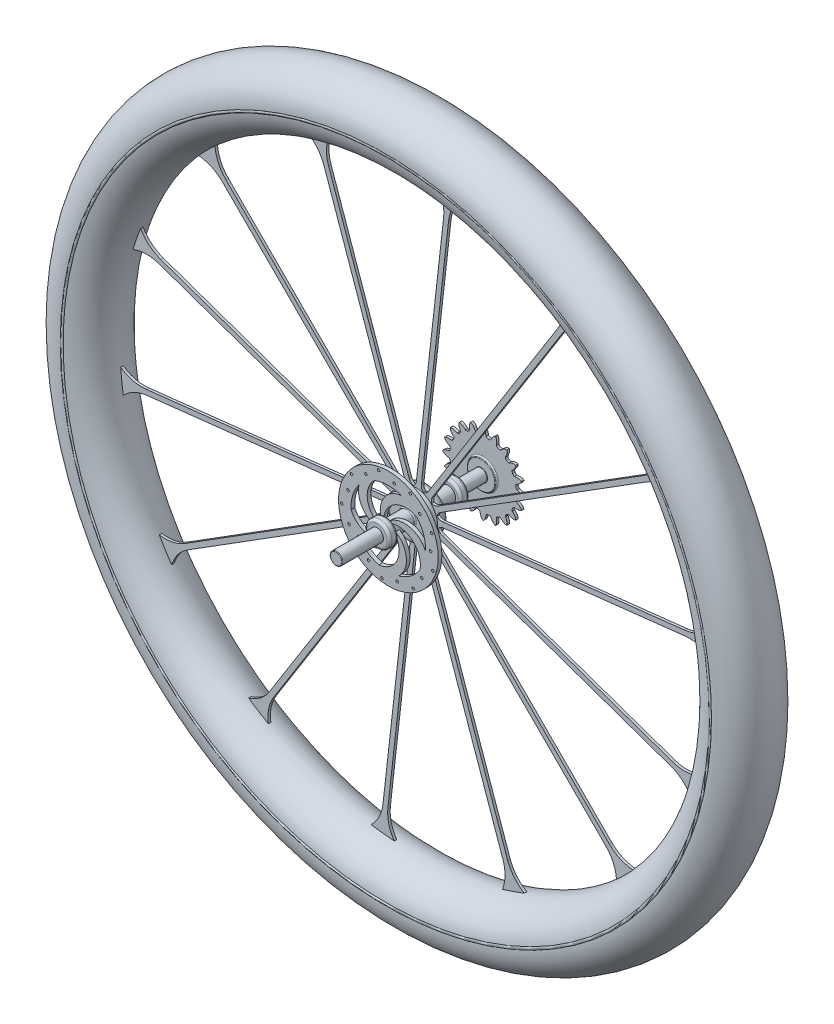
from build123d import *

# Parameters (mm, degrees)
SKETCH1_R               = 10
BOSS_EXTRUDE1_DEPTH     = 32
SKETCH1_5_R             = 5
BOSS_EXTRUDE2_DEPTH     = 65
SKETCH4_OUTSIDE_W       = 48.608
SKETCH4_OUTSIDE_H       = 48.608
SKETCH4_OUTSIDE_R       = 6
CUT_EXTRUDE1_DEPTH      = 25
FILLET3_R               = 2
FILLET4_R               = 2
FILLET5_R               = 0.5
SKETCH5_R               = 17.5
BOSS_EXTRUDE3_DEPTH     = 7.5
FILLET6_R               = 3
FILLET7_R               = 1
BOSS_EXTRUDE4_START     = 20
SKETCH6_R               = 40
SKETCH6_R_2             = 1
BOSS_EXTRUDE4_DEPTH     = 3
BOSS_EXTRUDE8_DEPTH     = 1
CIRPATTERN1_COUNT       = 14
SWEEP2_PROFILE_R        = 25
BOSS_EXTRUDE9_START     = -55
BOSS_EXTRUDE9_OUTLINE_R = 5
BOSS_EXTRUDE9_DEPTH     = 2
BOSS_EXTRUDE10_START    = -56.5
SKETCH54_R              = 11.326091277
BOSS_EXTRUDE10_DEPTH    = 5
FILLET8_R               = 0.2
FILLET9_R               = 1
FILLET10_R              = 0.5


# Read off the part's stored shape, not the designer's step: Boss-Extrude9
with BuildPart() as part:
    # Sketch1 → Boss-Extrude1 (new, symmetric)
    with BuildSketch(Plane.XY):
        Circle(SKETCH1_R)
    extrude(amount=BOSS_EXTRUDE1_DEPTH, both=True)

    # Sketch1<5> → Boss-Extrude2 (add, symmetric)
    with BuildSketch(Plane.XY):
        Circle(SKETCH1_5_R)
    extrude(amount=BOSS_EXTRUDE2_DEPTH, both=True)

    # Sketch4 outside → Cut-Extrude1 (cut, symmetric)
    with BuildSketch(Plane.XY):
        Rectangle(SKETCH4_OUTSIDE_W, SKETCH4_OUTSIDE_H)
        Circle(SKETCH4_OUTSIDE_R, mode=Mode.SUBTRACT)
    extrude(amount=CUT_EXTRUDE1_DEPTH, both=True, mode=Mode.SUBTRACT)

    # Fillet3
    fillet3_edges = [part.edges().sort_by_distance(p)[0] for p in [
        (-10, 0, -25),
        (-10, 0, -32),
    ]]
    fillet(fillet3_edges, radius=FILLET3_R)

    # Fillet4
    fillet4_edges = [part.edges().sort_by_distance(p)[0] for p in [
        (-10, 0, 32),
        (-10, 0, 25),
    ]]
    fillet(fillet4_edges, radius=FILLET4_R)

    # Fillet5
    fillet5_edges = [part.edges().sort_by_distance(p)[0] for p in [
        (-5, 0, -65),
        (-5, 0, 65),
    ]]
    fillet(fillet5_edges, radius=FILLET5_R)

    # Sketch5 → Boss-Extrude3 (add, symmetric)
    with BuildSketch(Plane.XY):
        Circle(SKETCH5_R)
    extrude(amount=BOSS_EXTRUDE3_DEPTH, both=True)

    # Fillet6
    fillet6_edges = [part.edges().sort_by_distance(p)[0] for p in [
        (-17.5, 0, -7.5),
        (-17.5, 0, 7.5),
    ]]
    fillet(fillet6_edges, radius=FILLET6_R)

    # Fillet7
    fillet7_edges = [part.edges().sort_by_distance(p)[0] for p in [
        (-6, 0, 7.5),
        (-6, 0, -7.5),
    ]]
    fillet(fillet7_edges, radius=FILLET7_R)

    # Sketch6 → Boss-Extrude4 (add)
    with BuildSketch(Plane.XY.offset(BOSS_EXTRUDE4_START)):
        Circle(SKETCH6_R)
        with Locations((-27.829963859, -25.134500424)):
            Circle(SKETCH6_R_2, mode=Mode.SUBTRACT)
        with Locations((-15.916629656, -30.044315609)):
            Circle(SKETCH6_R_2, mode=Mode.SUBTRACT)
        with Locations((-5.162843718, -37.142900328)):
            Circle(SKETCH6_R_2, mode=Mode.SUBTRACT)
        with Locations((-31.504959516, -12.784268689)):
            Circle(SKETCH6_R_2, mode=Mode.SUBTRACT)
        with Locations((-37.475134615, -1.365388434)):
            Circle(SKETCH6_R_2, mode=Mode.SUBTRACT)
        with Locations((7.119268114, -33.24629335)):
            Circle(SKETCH6_R_2, mode=Mode.SUBTRACT)
        with Locations((19.920028377, -31.77172437)):
            Circle(SKETCH6_R_2, mode=Mode.SUBTRACT)
        with Locations((26.823981211, -20.891960941)):
            Circle(SKETCH6_R_2, mode=Mode.SUBTRACT)
        with Locations((35.682097809, -11.534205476)):
            Circle(SKETCH6_R_2, mode=Mode.SUBTRACT)
        with Locations((-32.35176868, 10.457679632)):
            Circle(SKETCH6_R_2, mode=Mode.SUBTRACT)
        with Locations((-29.585273395, 23.04260398)):
            Circle(SKETCH6_R_2, mode=Mode.SUBTRACT)
        with Locations((-18.060825729, 28.806363429)):
            Circle(SKETCH6_R_2, mode=Mode.SUBTRACT)
        with Locations((-7.852133949, 36.668705901)):
            Circle(SKETCH6_R_2, mode=Mode.SUBTRACT)
        with BuildLine():
            ThreePointArc((-10.988413518, 27.915135113), (-0.354739854, 29.997902587), (10.325212752, 28.167179156))
            ThreePointArc((10.325212752, 28.167179156), (-3.757528665, 19.399381921), (-5.26423558, 2.878858066))
            ThreePointArc((-5.26423558, 2.878858066), (-4.598952731, 3.853522256), (-3.755770696, 4.679122405))
            ThreePointArc((-3.755770696, 4.679122405), (5.662140485, 19.42231461), (23.153264634, 19.07685343))
            ThreePointArc((23.153264634, 19.07685343), (28.420080087, 9.607239345), (29.979245493, -1.115723827))
            ThreePointArc((29.979245493, -1.115723827), (17.288768374, 9.568360816), (1.111218467, 5.896201618))
            ThreePointArc((1.111218467, 5.896201618), (2.243762902, 5.564667828), (3.289512882, 5.017878536))
            ThreePointArc((3.289512882, 5.017878536), (20.221416506, 0.61680968), (25.297918012, -16.124991295))
            ThreePointArc((25.297918012, -16.124991295), (17.919315311, -24.060302134), (8.20297992, -28.856734403))
            ThreePointArc((8.20297992, -28.856734403), (14.442575143, -13.48580972), (5.951006361, 0.765194939))
            ThreePointArc((5.951006361, 0.765194939), (5.987739063, 0.383380904), (6, 0))
            ThreePointArc((6, 0), (5.946965982, -0.795987193), (5.788801463, -1.577902919))
            ThreePointArc((5.788801463, -1.577902919), (6.835382216, -19.041105264), (-7.518291458, -29.042646118))
            ThreePointArc((-7.518291458, -29.042646118), (-17.34533417, -24.477323843), (-24.909525094, -16.718718839))
            ThreePointArc((-24.909525094, -16.718718839), (-8.36276605, -17.903049589), (2.566705732, -5.423285138))
            ThreePointArc((2.566705732, -5.423285138), (1.455587364, -5.820761585), (0.288163176, -5.99307617))
            ThreePointArc((0.288163176, -5.99307617), (-15.996917971, -12.384859916), (-29.94447767, -1.82435113))
            ThreePointArc((-29.94447767, -1.82435113), (-28.639321374, 8.932484045), (-23.597913072, 18.523997913))
            ThreePointArc((-23.597913072, 18.523997913), (-19.611048802, 2.421116572), (-4.364694979, -4.116969484))
            ThreePointArc((-4.364694979, -4.116969484), (-5.086072002, -3.183060098), (-5.610706826, -2.126021852))
            ThreePointArc((-5.610706826, -2.126021852), (-16.722021237, 11.386840889), (-10.988413518, 27.915135113))
        make_face(mode=Mode.SUBTRACT)
        with Locations((33.977455384, 1.23795218)):
            Circle(SKETCH6_R_2, mode=Mode.SUBTRACT)
        with Locations((34.748117113, 14.100296348)):
            Circle(SKETCH6_R_2, mode=Mode.SUBTRACT)
        with Locations((4.680978305, 33.67622963)):
            Circle(SKETCH6_R_2, mode=Mode.SUBTRACT)
        with Locations((17.555106238, 33.137112804)):
            Circle(SKETCH6_R_2, mode=Mode.SUBTRACT)
        with Locations((25.232500566, 22.788613718)):
            Circle(SKETCH6_R_2, mode=Mode.SUBTRACT)
    extrude(amount=BOSS_EXTRUDE4_DEPTH)

    # Sketch8 → Boss-Extrude8 (add, symmetric)
    with BuildSketch(Plane.XY):
        with BuildLine():
            ThreePointArc((-15.847816988, 7.422714915), (-12.374368671, 12.374368671), (-7.422714915, 15.847816988))
            ThreePointArc((-7.422714915, 15.847816988), (-11.004522471, 15.371626105), (-14.21028643, 17.038713554))
            Line((-14.21028643, 17.038713554), (-152.494850498, 155.323277623))
            ThreePointArc((-152.494850498, 155.323277623), (-161.201777759, 178.724123423), (-149.183689844, 200.609637567))
            ThreePointArc((-149.183689844, 200.609637567), (-176.776695297, 176.776695297), (-200.609637567, 149.183689844))
            ThreePointArc((-200.609637567, 149.183689844), (-178.724123423, 161.201777759), (-155.323277623, 152.494850498))
            Line((-155.323277623, 152.494850498), (-17.038713554, 14.21028643))
            ThreePointArc((-17.038713554, 14.21028643), (-15.371626105, 11.004522471), (-15.847816988, 7.422714915))
        make_face()
    boss_extrude8 = extrude(amount=BOSS_EXTRUDE8_DEPTH, both=True)

    # CirPattern1: Boss-Extrude8 ×14 about axis
    cirpattern1_axis = Axis((0, 0, 0), (0, 0, 1))
    for i in range(1, CIRPATTERN1_COUNT):
        add(boss_extrude8.rotate(cirpattern1_axis, i * 360 / CIRPATTERN1_COUNT))

    # Sketch28 → Revolve2 (revolve)
    with BuildSketch(Plane(origin=(-158.659775862, 199.629846274, 0), x_dir=(0, 0, 1), z_dir=(-0.7828621422498412, -0.6221951994607396, 0)), mode=Mode.PRIVATE) as revolve2_sk:
        with BuildLine():
            Line((-18.133205272, -4.636575391), (-22.581894268, 3.079745459))
            ThreePointArc((-22.581894268, 3.079745459), (-22.826148414, 3.380932745), (-23.152080767, 3.591032651))
            Line((-23.152080767, 3.591032651), (-24.580850557, 4.219111072))
            ThreePointArc((-24.580850557, 4.219111072), (-25.379303955, 5.224614361), (-25, 6.451273729))
            Line((-25, 6.451273729), (25, 6.451273729))
            ThreePointArc((25, 6.451273729), (25.379303955, 5.224614361), (24.580850557, 4.219111072))
            Line((24.580850557, 4.219111072), (23.152080767, 3.591032651))
            ThreePointArc((23.152080767, 3.591032651), (22.826148414, 3.380932745), (22.581894268, 3.079745459))
            Line((22.581894268, 3.079745459), (18.133205272, -4.636575391))
            ThreePointArc((18.133205272, -4.636575391), (16.302872781, -6.46859869), (13.801540167, -7.13924133))
            Line((13.801540167, -7.13924133), (0, -7.13924133))
            Line((0, -7.13924133), (-13.801540167, -7.13924133))
            ThreePointArc((-13.801540167, -7.13924133), (-16.302872781, -6.46859869), (-18.133205272, -4.636575391))
        make_face()
    revolve(revolve2_sk.sketch.rotate(Axis((0, 0, -64.5), (0, 0, -1)), 128.476617376), axis=Axis((0, 0, -64.5), (0, 0, -1)))

    # Sweep2: sweep along a path in Sketch30
    with BuildLine(Plane.XY) as sweep2_path:
        CenterArc((0, 0), 262.5, 0, 360)
    # Sweep2 profile (on start of the path) → Sweep2 (sweep)
    with BuildSketch(Plane(origin=(262.5, 0, 0), x_dir=(0, 0, 1), z_dir=(0, 1, 0))):
        Circle(SWEEP2_PROFILE_R)
    sweep(path=sweep2_path.line)

    # Boss-Extrude9 outline → Boss-Extrude9 (add)
    with BuildSketch(Plane.XY.offset(BOSS_EXTRUDE9_START)):
        with BuildLine():
            ThreePointArc((-20.928984964, 17.83893462), (-20.808155916, 17.979728791), (-20.68637973, 18.119704568))
            add(Edge.make_bspline(
                [(-20.68637973, 18.119704568), (-22.925550657, 19.029265096), (-24.165921378, 19.703947386), (-26.293052317, 19.1030207)],
                knots=[0, 0, 0, 0, 1, 1, 1, 1], degree=3))
            add(Edge.make_bspline(
                [(-23.625305992, 14.074619597), (-25.182291328, 15.923128037), (-26.207247949, 16.8943024), (-26.293052317, 19.1030207)],
                knots=[0, 0, 0, 0, 1, 1, 1, 1], degree=3))
            ThreePointArc((-23.625305992, 14.074619597), (-23.529812027, 14.233690525), (-23.433247043, 14.392113571))
            add(Edge.make_bspline(
                [(-23.770662791, 12.111757643), (-23.682791856, 12.264469454), (-23.177816023, 13.322083224), (-23.515185103, 14.199860603), (-23.433247043, 14.392113571)],
                knots=[0.475701449, 0.475701449, 0.475701449, 0.475701449, 0.55697972, 1, 1, 1, 1], degree=3))
            add(Edge.make_bspline(
                [(-23.770662791, 12.111757643), (-23.842560002, 11.950906814), (-24.401370167, 10.920723006), (-25.309807554, 10.677715727), (-25.417181489, 10.498422985)],
                knots=[0.475701449, 0.475701449, 0.475701449, 0.475701449, 0.55697972, 1, 1, 1, 1], degree=3))
            ThreePointArc((-25.417181489, 10.498422985), (-25.345774026, 10.669664428), (-25.273212886, 10.840420214))
            add(Edge.make_bspline(
                [(-25.273212886, 10.840420214), (-27.683860647, 11.013521811), (-29.072011597, 11.271887168), (-30.90933678, 10.043052317)],
                knots=[0, 0, 0, 0, 1, 1, 1, 1], degree=3))
            add(Edge.make_bspline(
                [(-26.818297858, 6.085137633), (-28.87029943, 7.362038702), (-30.145200486, 7.968951394), (-30.90933678, 10.043052317)],
                knots=[0, 0, 0, 0, 1, 1, 1, 1], degree=3))
            ThreePointArc((-26.818297858, 6.085137633), (-26.776633321, 6.265932334), (-26.733749976, 6.446441825))
            add(Edge.make_bspline(
                [(-26.349982687, 4.173427261), (-26.313603007, 4.345818436), (-26.160163079, 5.507715017), (-26.752268268, 6.238278134), (-26.733749976, 6.446441825)],
                knots=[0.475701449, 0.475701449, 0.475701449, 0.475701449, 0.55697972, 1, 1, 1, 1], degree=3))
            add(Edge.make_bspline(
                [(-26.349982687, 4.173427261), (-26.368655358, 3.998231571), (-26.581771104, 2.84578671), (-27.370653021, 2.333950463), (-27.417367197, 2.130252562)],
                knots=[0.475701449, 0.475701449, 0.475701449, 0.475701449, 0.55697972, 1, 1, 1, 1], degree=3))
            ThreePointArc((-27.417367197, 2.130252562), (-27.402371181, 2.315178972), (-27.386127875, 2.5))
            add(Edge.make_bspline(
                [(-27.386127875, 2.5), (-29.732281472, 1.919698276), (-31.132330765, 1.736456098), (-32.5, 0)],
                knots=[0, 0, 0, 0, 1, 1, 1, 1], degree=3))
            add(Edge.make_bspline(
                [(-27.386127875, -2.5), (-29.732281472, -1.919698276), (-31.132330765, -1.736456098), (-32.5, 0)],
                knots=[0, 0, 0, 0, 1, 1, 1, 1], degree=3))
            ThreePointArc((-27.386127875, -2.5), (-27.402371181, -2.315178972), (-27.417367197, -2.130252562))
            add(Edge.make_bspline(
                [(-26.349982687, -4.17342726), (-26.368655358, -3.998231571), (-26.581771104, -2.84578671), (-27.370653021, -2.333950463), (-27.417367197, -2.130252562)],
                knots=[0.475701449, 0.475701449, 0.475701449, 0.475701449, 0.55697972, 1, 1, 1, 1], degree=3))
            add(Edge.make_bspline(
                [(-26.349982687, -4.17342726), (-26.313603007, -4.345818435), (-26.160163079, -5.507715017), (-26.752268268, -6.238278134), (-26.733749976, -6.446441825)],
                knots=[0.475701449, 0.475701449, 0.475701449, 0.475701449, 0.55697972, 1, 1, 1, 1], degree=3))
            ThreePointArc((-26.733749976, -6.446441825), (-26.776633321, -6.265932334), (-26.818297858, -6.085137633))
            add(Edge.make_bspline(
                [(-26.818297858, -6.085137633), (-28.87029943, -7.362038702), (-30.145200486, -7.968951394), (-30.90933678, -10.043052317)],
                knots=[0, 0, 0, 0, 1, 1, 1, 1], degree=3))
            add(Edge.make_bspline(
                [(-25.273212886, -10.840420214), (-27.683860647, -11.013521811), (-29.072011597, -11.271887168), (-30.90933678, -10.043052317)],
                knots=[0, 0, 0, 0, 1, 1, 1, 1], degree=3))
            ThreePointArc((-25.273212886, -10.840420214), (-25.345774026, -10.669664428), (-25.417181489, -10.498422985))
            add(Edge.make_bspline(
                [(-23.770662791, -12.111757643), (-23.842560002, -11.950906814), (-24.401370167, -10.920723006), (-25.309807554, -10.677715727), (-25.417181489, -10.498422985)],
                knots=[0.475701449, 0.475701449, 0.475701449, 0.475701449, 0.55697972, 1, 1, 1, 1], degree=3))
            add(Edge.make_bspline(
                [(-23.770662791, -12.111757643), (-23.682791856, -12.264469454), (-23.177816023, -13.322083224), (-23.515185103, -14.199860603), (-23.433247043, -14.392113571)],
                knots=[0.475701449, 0.475701449, 0.475701449, 0.475701449, 0.55697972, 1, 1, 1, 1], degree=3))
            ThreePointArc((-23.433247043, -14.392113571), (-23.529812027, -14.233690525), (-23.625305992, -14.074619597))
            add(Edge.make_bspline(
                [(-23.625305992, -14.074619597), (-25.182291328, -15.923128037), (-26.207247949, -16.8943024), (-26.293052317, -19.1030207)],
                knots=[0, 0, 0, 0, 1, 1, 1, 1], degree=3))
            add(Edge.make_bspline(
                [(-20.68637973, -18.119704568), (-22.925550657, -19.029265096), (-24.165921378, -19.703947386), (-26.293052317, -19.1030207)],
                knots=[0, 0, 0, 0, 1, 1, 1, 1], degree=3))
            ThreePointArc((-20.68637973, -18.119704568), (-20.808155916, -17.979728791), (-20.928984964, -17.83893462))
            add(Edge.make_bspline(
                [(-18.8645048, -18.8645048), (-18.982588751, -18.733744031), (-19.832393104, -17.926662845), (-20.771461779, -17.97627178), (-20.928984964, -17.83893462)],
                knots=[0.475701449, 0.475701449, 0.475701449, 0.475701449, 0.55697972, 1, 1, 1, 1], degree=3))
            add(Edge.make_bspline(
                [(-18.8645048, -18.8645048), (-18.733744031, -18.982588751), (-17.926662845, -19.832393104), (-17.97627178, -20.771461779), (-17.83893462, -20.928984964)],
                knots=[0.475701449, 0.475701449, 0.475701449, 0.475701449, 0.55697972, 1, 1, 1, 1], degree=3))
            ThreePointArc((-17.83893462, -20.928984964), (-17.979728791, -20.808155916), (-18.119704568, -20.68637973))
            add(Edge.make_bspline(
                [(-18.119704568, -20.68637973), (-19.029265096, -22.925550657), (-19.703947386, -24.165921378), (-19.1030207, -26.293052317)],
                knots=[0, 0, 0, 0, 1, 1, 1, 1], degree=3))
            add(Edge.make_bspline(
                [(-14.074619597, -23.625305992), (-15.923128037, -25.182291328), (-16.8943024, -26.207247949), (-19.1030207, -26.293052317)],
                knots=[0, 0, 0, 0, 1, 1, 1, 1], degree=3))
            ThreePointArc((-14.074619597, -23.625305992), (-14.233690525, -23.529812027), (-14.392113571, -23.433247043))
            add(Edge.make_bspline(
                [(-12.111757643, -23.770662791), (-12.264469454, -23.682791856), (-13.322083224, -23.177816023), (-14.199860603, -23.515185103), (-14.392113571, -23.433247043)],
                knots=[0.475701449, 0.475701449, 0.475701449, 0.475701449, 0.55697972, 1, 1, 1, 1], degree=3))
            add(Edge.make_bspline(
                [(-12.111757643, -23.770662791), (-11.950906814, -23.842560002), (-10.920723006, -24.401370167), (-10.677715727, -25.309807554), (-10.498422985, -25.417181489)],
                knots=[0.475701449, 0.475701449, 0.475701449, 0.475701449, 0.55697972, 1, 1, 1, 1], degree=3))
            ThreePointArc((-10.498422985, -25.417181489), (-10.669664428, -25.345774026), (-10.840420214, -25.273212886))
            add(Edge.make_bspline(
                [(-10.840420214, -25.273212886), (-11.013521811, -27.683860647), (-11.271887168, -29.072011597), (-10.043052317, -30.90933678)],
                knots=[0, 0, 0, 0, 1, 1, 1, 1], degree=3))
            add(Edge.make_bspline(
                [(-6.085137633, -26.818297858), (-7.362038702, -28.87029943), (-7.968951394, -30.145200486), (-10.043052317, -30.90933678)],
                knots=[0, 0, 0, 0, 1, 1, 1, 1], degree=3))
            ThreePointArc((-6.085137633, -26.818297858), (-6.265932334, -26.776633321), (-6.446441825, -26.733749976))
            add(Edge.make_bspline(
                [(-4.173427261, -26.349982687), (-4.345818436, -26.313603007), (-5.507715017, -26.160163079), (-6.238278134, -26.752268268), (-6.446441825, -26.733749976)],
                knots=[0.475701449, 0.475701449, 0.475701449, 0.475701449, 0.55697972, 1, 1, 1, 1], degree=3))
            add(Edge.make_bspline(
                [(-4.173427261, -26.349982687), (-3.998231571, -26.368655358), (-2.84578671, -26.581771104), (-2.333950463, -27.370653021), (-2.130252562, -27.417367197)],
                knots=[0.475701449, 0.475701449, 0.475701449, 0.475701449, 0.55697972, 1, 1, 1, 1], degree=3))
            ThreePointArc((-2.130252562, -27.417367197), (-2.315178972, -27.402371181), (-2.5, -27.386127875))
            add(Edge.make_bspline(
                [(-2.5, -27.386127875), (-1.919698276, -29.732281472), (-1.736456098, -31.132330765), (0, -32.5)],
                knots=[0, 0, 0, 0, 1, 1, 1, 1], degree=3))
            add(Edge.make_bspline(
                [(2.5, -27.386127875), (1.919698276, -29.732281472), (1.736456098, -31.132330765), (0, -32.5)],
                knots=[0, 0, 0, 0, 1, 1, 1, 1], degree=3))
            ThreePointArc((2.5, -27.386127875), (2.315178972, -27.402371181), (2.130252562, -27.417367197))
            add(Edge.make_bspline(
                [(4.17342726, -26.349982687), (3.998231571, -26.368655358), (2.84578671, -26.581771104), (2.333950463, -27.370653021), (2.130252562, -27.417367197)],
                knots=[0.475701449, 0.475701449, 0.475701449, 0.475701449, 0.55697972, 1, 1, 1, 1], degree=3))
            add(Edge.make_bspline(
                [(4.17342726, -26.349982687), (4.345818435, -26.313603007), (5.507715017, -26.160163079), (6.238278134, -26.752268268), (6.446441825, -26.733749976)],
                knots=[0.475701449, 0.475701449, 0.475701449, 0.475701449, 0.55697972, 1, 1, 1, 1], degree=3))
            ThreePointArc((6.446441825, -26.733749976), (6.265932334, -26.776633321), (6.085137633, -26.818297858))
            add(Edge.make_bspline(
                [(6.085137633, -26.818297858), (7.362038702, -28.87029943), (7.968951394, -30.145200486), (10.043052317, -30.90933678)],
                knots=[0, 0, 0, 0, 1, 1, 1, 1], degree=3))
            add(Edge.make_bspline(
                [(10.840420214, -25.273212886), (11.013521811, -27.683860647), (11.271887168, -29.072011597), (10.043052317, -30.90933678)],
                knots=[0, 0, 0, 0, 1, 1, 1, 1], degree=3))
            ThreePointArc((10.840420214, -25.273212886), (10.669664428, -25.345774026), (10.498422985, -25.417181489))
            add(Edge.make_bspline(
                [(12.111757643, -23.770662791), (11.950906814, -23.842560002), (10.920723006, -24.401370167), (10.677715727, -25.309807554), (10.498422985, -25.417181489)],
                knots=[0.475701449, 0.475701449, 0.475701449, 0.475701449, 0.55697972, 1, 1, 1, 1], degree=3))
            add(Edge.make_bspline(
                [(12.111757643, -23.770662791), (12.264469454, -23.682791856), (13.322083224, -23.177816023), (14.199860603, -23.515185103), (14.392113571, -23.433247043)],
                knots=[0.475701449, 0.475701449, 0.475701449, 0.475701449, 0.55697972, 1, 1, 1, 1], degree=3))
            ThreePointArc((14.392113571, -23.433247043), (14.233690525, -23.529812027), (14.074619597, -23.625305992))
            add(Edge.make_bspline(
                [(14.074619597, -23.625305992), (15.923128037, -25.182291328), (16.8943024, -26.207247949), (19.1030207, -26.293052317)],
                knots=[0, 0, 0, 0, 1, 1, 1, 1], degree=3))
            add(Edge.make_bspline(
                [(18.119704568, -20.68637973), (19.029265096, -22.925550657), (19.703947386, -24.165921378), (19.1030207, -26.293052317)],
                knots=[0, 0, 0, 0, 1, 1, 1, 1], degree=3))
            ThreePointArc((18.119704568, -20.68637973), (17.979728791, -20.808155916), (17.83893462, -20.928984964))
            add(Edge.make_bspline(
                [(18.8645048, -18.8645048), (18.733744031, -18.982588751), (17.926662845, -19.832393104), (17.97627178, -20.771461779), (17.83893462, -20.928984964)],
                knots=[0.475701449, 0.475701449, 0.475701449, 0.475701449, 0.55697972, 1, 1, 1, 1], degree=3))
            add(Edge.make_bspline(
                [(18.8645048, -18.8645048), (18.982588751, -18.733744031), (19.832393104, -17.926662845), (20.771461779, -17.97627178), (20.928984964, -17.83893462)],
                knots=[0.475701449, 0.475701449, 0.475701449, 0.475701449, 0.55697972, 1, 1, 1, 1], degree=3))
            ThreePointArc((20.928984964, -17.83893462), (20.808155916, -17.979728791), (20.68637973, -18.119704568))
            add(Edge.make_bspline(
                [(20.68637973, -18.119704568), (22.925550657, -19.029265096), (24.165921378, -19.703947386), (26.293052317, -19.1030207)],
                knots=[0, 0, 0, 0, 1, 1, 1, 1], degree=3))
            add(Edge.make_bspline(
                [(23.625305992, -14.074619597), (25.182291328, -15.923128037), (26.207247949, -16.8943024), (26.293052317, -19.1030207)],
                knots=[0, 0, 0, 0, 1, 1, 1, 1], degree=3))
            ThreePointArc((23.625305992, -14.074619597), (23.529812027, -14.233690525), (23.433247043, -14.392113571))
            add(Edge.make_bspline(
                [(23.770662791, -12.111757643), (23.682791856, -12.264469454), (23.177816023, -13.322083224), (23.515185103, -14.199860603), (23.433247043, -14.392113571)],
                knots=[0.475701449, 0.475701449, 0.475701449, 0.475701449, 0.55697972, 1, 1, 1, 1], degree=3))
            add(Edge.make_bspline(
                [(23.770662791, -12.111757643), (23.842560002, -11.950906814), (24.401370167, -10.920723006), (25.309807554, -10.677715727), (25.417181489, -10.498422985)],
                knots=[0.475701449, 0.475701449, 0.475701449, 0.475701449, 0.55697972, 1, 1, 1, 1], degree=3))
            ThreePointArc((25.417181489, -10.498422985), (25.345774026, -10.669664428), (25.273212886, -10.840420214))
            add(Edge.make_bspline(
                [(25.273212886, -10.840420214), (27.683860647, -11.013521811), (29.072011597, -11.271887168), (30.90933678, -10.043052317)],
                knots=[0, 0, 0, 0, 1, 1, 1, 1], degree=3))
            add(Edge.make_bspline(
                [(26.818297858, -6.085137633), (28.87029943, -7.362038702), (30.145200486, -7.968951394), (30.90933678, -10.043052317)],
                knots=[0, 0, 0, 0, 1, 1, 1, 1], degree=3))
            ThreePointArc((26.818297858, -6.085137633), (26.776633321, -6.265932334), (26.733749976, -6.446441825))
            add(Edge.make_bspline(
                [(26.349982687, -4.173427261), (26.313603007, -4.345818436), (26.160163079, -5.507715017), (26.752268268, -6.238278134), (26.733749976, -6.446441825)],
                knots=[0.475701449, 0.475701449, 0.475701449, 0.475701449, 0.55697972, 1, 1, 1, 1], degree=3))
            add(Edge.make_bspline(
                [(26.349982687, -4.173427261), (26.368655358, -3.998231571), (26.581771104, -2.84578671), (27.370653021, -2.333950463), (27.417367197, -2.130252562)],
                knots=[0.475701449, 0.475701449, 0.475701449, 0.475701449, 0.55697972, 1, 1, 1, 1], degree=3))
            ThreePointArc((27.417367197, -2.130252562), (27.402371181, -2.315178972), (27.386127875, -2.5))
            add(Edge.make_bspline(
                [(27.386127875, -2.5), (29.732281472, -1.919698276), (31.132330765, -1.736456098), (32.5, 0)],
                knots=[0, 0, 0, 0, 1, 1, 1, 1], degree=3))
            add(Edge.make_bspline(
                [(27.386127875, 2.5), (29.732281472, 1.919698276), (31.132330765, 1.736456098), (32.5, 0)],
                knots=[0, 0, 0, 0, 1, 1, 1, 1], degree=3))
            ThreePointArc((27.386127875, 2.5), (27.402371181, 2.315178972), (27.417367197, 2.130252562))
            add(Edge.make_bspline(
                [(26.349982687, 4.17342726), (26.368655358, 3.998231571), (26.581771104, 2.84578671), (27.370653021, 2.333950463), (27.417367197, 2.130252562)],
                knots=[0.475701449, 0.475701449, 0.475701449, 0.475701449, 0.55697972, 1, 1, 1, 1], degree=3))
            add(Edge.make_bspline(
                [(26.349982687, 4.17342726), (26.313603007, 4.345818435), (26.160163079, 5.507715017), (26.752268268, 6.238278134), (26.733749976, 6.446441825)],
                knots=[0.475701449, 0.475701449, 0.475701449, 0.475701449, 0.55697972, 1, 1, 1, 1], degree=3))
            ThreePointArc((26.733749976, 6.446441825), (26.776633321, 6.265932334), (26.818297858, 6.085137633))
            add(Edge.make_bspline(
                [(26.818297858, 6.085137633), (28.87029943, 7.362038702), (30.145200486, 7.968951394), (30.90933678, 10.043052317)],
                knots=[0, 0, 0, 0, 1, 1, 1, 1], degree=3))
            add(Edge.make_bspline(
                [(25.273212886, 10.840420214), (27.683860647, 11.013521811), (29.072011597, 11.271887168), (30.90933678, 10.043052317)],
                knots=[0, 0, 0, 0, 1, 1, 1, 1], degree=3))
            ThreePointArc((25.273212886, 10.840420214), (25.345774026, 10.669664428), (25.417181489, 10.498422985))
            add(Edge.make_bspline(
                [(23.770662791, 12.111757643), (23.842560002, 11.950906814), (24.401370167, 10.920723006), (25.309807554, 10.677715727), (25.417181489, 10.498422985)],
                knots=[0.475701449, 0.475701449, 0.475701449, 0.475701449, 0.55697972, 1, 1, 1, 1], degree=3))
            add(Edge.make_bspline(
                [(23.770662791, 12.111757643), (23.682791856, 12.264469454), (23.177816023, 13.322083224), (23.515185103, 14.199860603), (23.433247043, 14.392113571)],
                knots=[0.475701449, 0.475701449, 0.475701449, 0.475701449, 0.55697972, 1, 1, 1, 1], degree=3))
            ThreePointArc((23.433247043, 14.392113571), (23.529812027, 14.233690525), (23.625305992, 14.074619597))
            add(Edge.make_bspline(
                [(23.625305992, 14.074619597), (25.182291328, 15.923128037), (26.207247949, 16.8943024), (26.293052317, 19.1030207)],
                knots=[0, 0, 0, 0, 1, 1, 1, 1], degree=3))
            add(Edge.make_bspline(
                [(20.68637973, 18.119704568), (22.925550657, 19.029265096), (24.165921378, 19.703947386), (26.293052317, 19.1030207)],
                knots=[0, 0, 0, 0, 1, 1, 1, 1], degree=3))
            ThreePointArc((20.68637973, 18.119704568), (20.808155916, 17.979728791), (20.928984964, 17.83893462))
            add(Edge.make_bspline(
                [(18.8645048, 18.8645048), (18.982588751, 18.733744031), (19.832393104, 17.926662845), (20.771461779, 17.97627178), (20.928984964, 17.83893462)],
                knots=[0.475701449, 0.475701449, 0.475701449, 0.475701449, 0.55697972, 1, 1, 1, 1], degree=3))
            add(Edge.make_bspline(
                [(18.8645048, 18.8645048), (18.733744031, 18.982588751), (17.926662845, 19.832393104), (17.97627178, 20.771461779), (17.83893462, 20.928984964)],
                knots=[0.475701449, 0.475701449, 0.475701449, 0.475701449, 0.55697972, 1, 1, 1, 1], degree=3))
            ThreePointArc((17.83893462, 20.928984964), (17.979728791, 20.808155916), (18.119704568, 20.68637973))
            add(Edge.make_bspline(
                [(18.119704568, 20.68637973), (19.029265096, 22.925550657), (19.703947386, 24.165921378), (19.1030207, 26.293052317)],
                knots=[0, 0, 0, 0, 1, 1, 1, 1], degree=3))
            add(Edge.make_bspline(
                [(14.074619597, 23.625305992), (15.923128037, 25.182291328), (16.8943024, 26.207247949), (19.1030207, 26.293052317)],
                knots=[0, 0, 0, 0, 1, 1, 1, 1], degree=3))
            ThreePointArc((14.074619597, 23.625305992), (14.233690525, 23.529812027), (14.392113571, 23.433247043))
            add(Edge.make_bspline(
                [(12.111757643, 23.770662791), (12.264469454, 23.682791856), (13.322083224, 23.177816023), (14.199860603, 23.515185103), (14.392113571, 23.433247043)],
                knots=[0.475701449, 0.475701449, 0.475701449, 0.475701449, 0.55697972, 1, 1, 1, 1], degree=3))
            add(Edge.make_bspline(
                [(12.111757643, 23.770662791), (11.950906814, 23.842560002), (10.920723006, 24.401370167), (10.677715727, 25.309807554), (10.498422985, 25.417181489)],
                knots=[0.475701449, 0.475701449, 0.475701449, 0.475701449, 0.55697972, 1, 1, 1, 1], degree=3))
            ThreePointArc((10.498422985, 25.417181489), (10.669664428, 25.345774026), (10.840420214, 25.273212886))
            add(Edge.make_bspline(
                [(10.840420214, 25.273212886), (11.013521811, 27.683860647), (11.271887168, 29.072011597), (10.043052317, 30.90933678)],
                knots=[0, 0, 0, 0, 1, 1, 1, 1], degree=3))
            add(Edge.make_bspline(
                [(6.085137633, 26.818297858), (7.362038702, 28.87029943), (7.968951394, 30.145200486), (10.043052317, 30.90933678)],
                knots=[0, 0, 0, 0, 1, 1, 1, 1], degree=3))
            ThreePointArc((6.085137633, 26.818297858), (6.265932334, 26.776633321), (6.446441825, 26.733749976))
            add(Edge.make_bspline(
                [(4.173427261, 26.349982687), (4.345818436, 26.313603007), (5.507715017, 26.160163079), (6.238278134, 26.752268268), (6.446441825, 26.733749976)],
                knots=[0.475701449, 0.475701449, 0.475701449, 0.475701449, 0.55697972, 1, 1, 1, 1], degree=3))
            add(Edge.make_bspline(
                [(4.173427261, 26.349982687), (3.998231571, 26.368655358), (2.84578671, 26.581771104), (2.333950463, 27.370653021), (2.130252562, 27.417367197)],
                knots=[0.475701449, 0.475701449, 0.475701449, 0.475701449, 0.55697972, 1, 1, 1, 1], degree=3))
            ThreePointArc((2.130252562, 27.417367197), (2.315178972, 27.402371181), (2.5, 27.386127875))
            add(Edge.make_bspline(
                [(2.5, 27.386127875), (1.919698275, 29.732281472), (1.736456098, 31.132330765), (0, 32.5)],
                knots=[0, 0, 0, 0, 1, 1, 1, 1], degree=3))
            add(Edge.make_bspline(
                [(-2.5, 27.386127875), (-1.919698275, 29.732281472), (-1.736456098, 31.132330765), (0, 32.5)],
                knots=[0, 0, 0, 0, 1, 1, 1, 1], degree=3))
            ThreePointArc((-2.5, 27.386127875), (-2.315178972, 27.402371181), (-2.130252562, 27.417367197))
            add(Edge.make_bspline(
                [(-4.173427261, 26.349982687), (-3.998231571, 26.368655358), (-2.84578671, 26.581771104), (-2.333950463, 27.370653021), (-2.130252562, 27.417367197)],
                knots=[0.475701449, 0.475701449, 0.475701449, 0.475701449, 0.55697972, 1, 1, 1, 1], degree=3))
            add(Edge.make_bspline(
                [(-4.173427261, 26.349982687), (-4.345818436, 26.313603007), (-5.507715017, 26.160163079), (-6.238278134, 26.752268268), (-6.446441825, 26.733749976)],
                knots=[0.475701449, 0.475701449, 0.475701449, 0.475701449, 0.55697972, 1, 1, 1, 1], degree=3))
            ThreePointArc((-6.446441825, 26.733749976), (-6.265932334, 26.776633321), (-6.085137633, 26.818297858))
            add(Edge.make_bspline(
                [(-6.085137633, 26.818297858), (-7.362038702, 28.87029943), (-7.968951394, 30.145200486), (-10.043052317, 30.90933678)],
                knots=[0, 0, 0, 0, 1, 1, 1, 1], degree=3))
            add(Edge.make_bspline(
                [(-10.840420214, 25.273212886), (-11.013521811, 27.683860647), (-11.271887168, 29.072011597), (-10.043052317, 30.90933678)],
                knots=[0, 0, 0, 0, 1, 1, 1, 1], degree=3))
            ThreePointArc((-10.840420214, 25.273212886), (-10.669664428, 25.345774026), (-10.498422985, 25.417181489))
            add(Edge.make_bspline(
                [(-12.111757643, 23.770662791), (-11.950906814, 23.842560002), (-10.920723006, 24.401370167), (-10.677715727, 25.309807554), (-10.498422985, 25.417181489)],
                knots=[0.475701449, 0.475701449, 0.475701449, 0.475701449, 0.55697972, 1, 1, 1, 1], degree=3))
            add(Edge.make_bspline(
                [(-12.111757643, 23.770662791), (-12.264469454, 23.682791856), (-13.322083224, 23.177816023), (-14.199860603, 23.515185103), (-14.392113571, 23.433247043)],
                knots=[0.475701449, 0.475701449, 0.475701449, 0.475701449, 0.55697972, 1, 1, 1, 1], degree=3))
            ThreePointArc((-14.392113571, 23.433247043), (-14.233690525, 23.529812027), (-14.074619597, 23.625305992))
            add(Edge.make_bspline(
                [(-14.074619597, 23.625305992), (-15.923128037, 25.182291328), (-16.8943024, 26.207247949), (-19.1030207, 26.293052317)],
                knots=[0, 0, 0, 0, 1, 1, 1, 1], degree=3))
            add(Edge.make_bspline(
                [(-18.119704568, 20.68637973), (-19.029265096, 22.925550657), (-19.703947386, 24.165921378), (-19.1030207, 26.293052317)],
                knots=[0, 0, 0, 0, 1, 1, 1, 1], degree=3))
            ThreePointArc((-18.119704568, 20.68637973), (-17.979728791, 20.808155916), (-17.83893462, 20.928984964))
            add(Edge.make_bspline(
                [(-18.8645048, 18.8645048), (-18.733744031, 18.982588751), (-17.926662845, 19.832393104), (-17.97627178, 20.771461779), (-17.83893462, 20.928984964)],
                knots=[0.475701449, 0.475701449, 0.475701449, 0.475701449, 0.55697972, 1, 1, 1, 1], degree=3))
            add(Edge.make_bspline(
                [(-18.8645048, 18.8645048), (-18.982588751, 18.733744031), (-19.832393104, 17.926662845), (-20.771461779, 17.97627178), (-20.928984964, 17.83893462)],
                knots=[0.475701449, 0.475701449, 0.475701449, 0.475701449, 0.55697972, 1, 1, 1, 1], degree=3))
        make_face()
        Circle(BOSS_EXTRUDE9_OUTLINE_R, mode=Mode.SUBTRACT)
    extrude(amount=BOSS_EXTRUDE9_DEPTH)

    # Sketch54 → Boss-Extrude10 (add)
    with BuildSketch(Plane.XY.offset(BOSS_EXTRUDE10_START)):
        Circle(SKETCH54_R)
    extrude(amount=BOSS_EXTRUDE10_DEPTH)

    # Fillet8
    fillet8_edges = [part.edges().sort_by_distance(p)[0] for p in [
        (-5, 0, -56.5),
        (-5, 0, -51.5),
    ]]
    fillet(fillet8_edges, radius=FILLET8_R)

    # Fillet9
    fillet9_edges = [part.edges().sort_by_distance(p)[0] for p in [
        (-11.326091277, 0, -55),
        (-11.326091277, 0, -53),
    ]]
    fillet(fillet9_edges, radius=FILLET9_R)

    # Fillet10
    fillet10_edges = [part.edges().sort_by_distance(p)[0] for p in [
        (-11.326091277, 0, -56.5),
        (-11.326091277, 0, -51.5),
    ]]
    fillet(fillet10_edges, radius=FILLET10_R - 0.0001)  # a hair under: the kernel refuses the full size


solid = part.part
